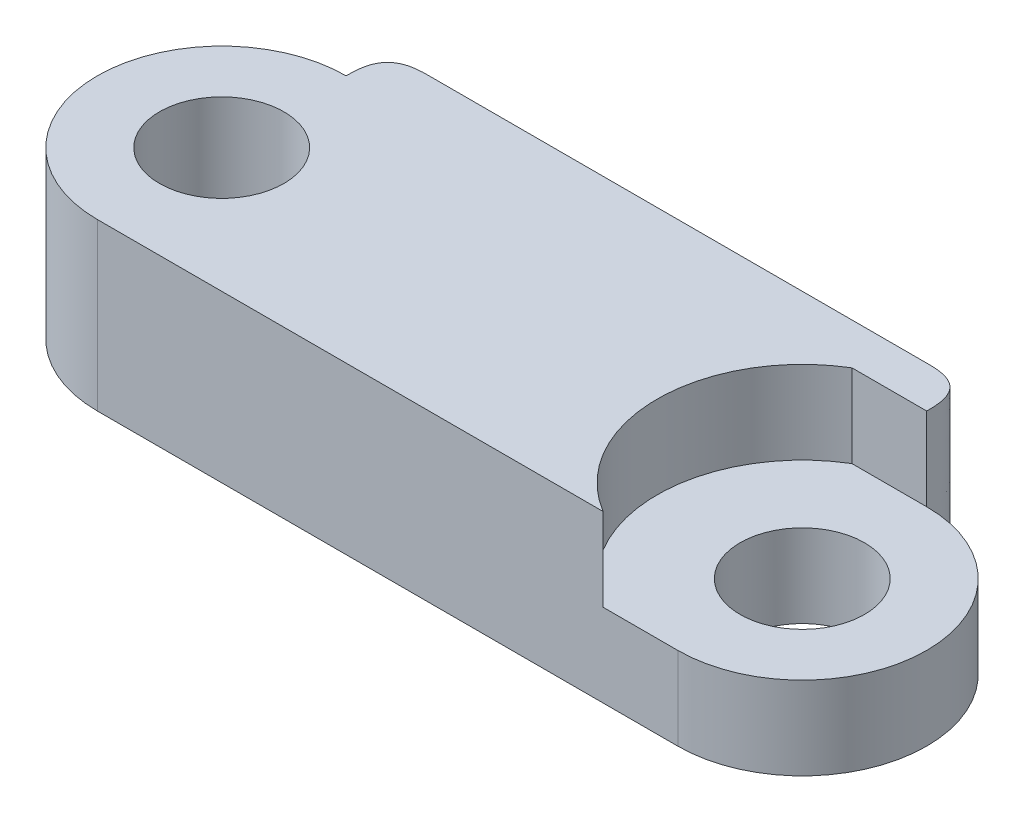
from build123d import *

# Parameters (mm, degrees)
SKETCH1_R           = 1.5
BOSS_EXTRUDE1_DEPTH = 2
CUT_EXTRUDE1_DEPTH  = 2
BOSS_EXTRUDE2_REACH = 13.18
SKETCH3_W           = 14
SKETCH3_H           = 1
FILLET1_SIZE        = 1


with BuildPart() as part:
    # Sketch1 → Boss-Extrude1 (new, symmetric)
    with BuildSketch(Plane(origin=(0, 0, 0), x_dir=(1, 0, 0), z_dir=(0, 1, 0))):
        with BuildLine():
            Line((-7, 3), (7, 3))
            ThreePointArc((7, 3), (10, 0), (7, -3))
            Line((7, -3), (-7, -3))
            ThreePointArc((-7, -3), (-10, 0), (-7, 3))
        make_face()
        with Locations(Location((-7, 0, 0), (0, 0, 270))):
            Circle(SKETCH1_R, mode=Mode.SUBTRACT)
        with Locations(Location((7, 0, 0), (0, 0, 270))):
            Circle(SKETCH1_R, mode=Mode.SUBTRACT)
    extrude(amount=BOSS_EXTRUDE1_DEPTH, both=True)

    # Sketch2 → Cut-Extrude1 (cut)
    with BuildSketch(Plane(origin=(0, 2, 0), x_dir=(1, 0, 0), z_dir=(0, 1, 0))):
        with BuildLine():
            Line((5.197224362, 3), (7, 3))
            ThreePointArc((7, 3), (10, 0), (7, -3))
            Line((7, -3), (5.197224362, -3))
            ThreePointArc((5.197224362, -3), (3.5, 0), (5.197224362, 3))
        make_face()
    extrude(amount=-CUT_EXTRUDE1_DEPTH, mode=Mode.SUBTRACT)

    # Boss-Extrude2: up to this face of the body (flat: up to its plane)
    boss_extrude2_end = Plane(part.part.faces().sort_by_distance((-2.270949872, 2, 0))[0])
    # Sketch3 → Boss-Extrude2 (add, up to the picked face)
    with BuildSketch(Plane.XZ.offset(2), mode=Mode.PRIVATE) as boss_extrude2_sk1:
        with Locations((0, -3.5)):
            Rectangle(SKETCH3_W, SKETCH3_H)
    boss_extrude2_tool1 = split(extrude(boss_extrude2_sk1.sketch, amount=-BOSS_EXTRUDE2_REACH, mode=Mode.PRIVATE), bisect_by=boss_extrude2_end, keep=Keep.BOTH, mode=Mode.PRIVATE)
    add(boss_extrude2_tool1.solids().sort_by(Axis((0, -2, -3.5), (0, 1, 0)))[0])

    # Fillet1
    # a fillet whose section is not a circle: 1 mm, written as the material it takes off along each edge
    with BuildSketch(Plane(origin=(7, -4.5, -4), x_dir=(0, 0, 1), z_dir=(0, 1, 0)), Plane(origin=(-7, -4.5, -4), x_dir=(1, 0, 0), z_dir=(0, 1, 0))) as fillet1_piece_1:
        with BuildLine():
            add(Edge.make_bspline([(FILLET1_SIZE, 0), (FILLET1_SIZE * 0.831801948466, 0), (FILLET1_SIZE * 0.663603896932, 0), (FILLET1_SIZE * 0.292893218813, -FILLET1_SIZE * 0.0716919198361), (FILLET1_SIZE * 0.0716919198361, -FILLET1_SIZE * 0.292893218813), (0, -FILLET1_SIZE * 0.663603896932), (0, -FILLET1_SIZE * 0.831801948466), (0, -FILLET1_SIZE)], knots=[0, 0, 0, 0, 0, 0, 0.5, 0.5, 1, 1, 1, 1, 1, 1], degree=5))
            Line((0, -FILLET1_SIZE), (0, 0))
            Line((0, 0), (FILLET1_SIZE, 0))
        make_face()
    extrude(amount=9, mode=Mode.SUBTRACT)


solid = part.part
